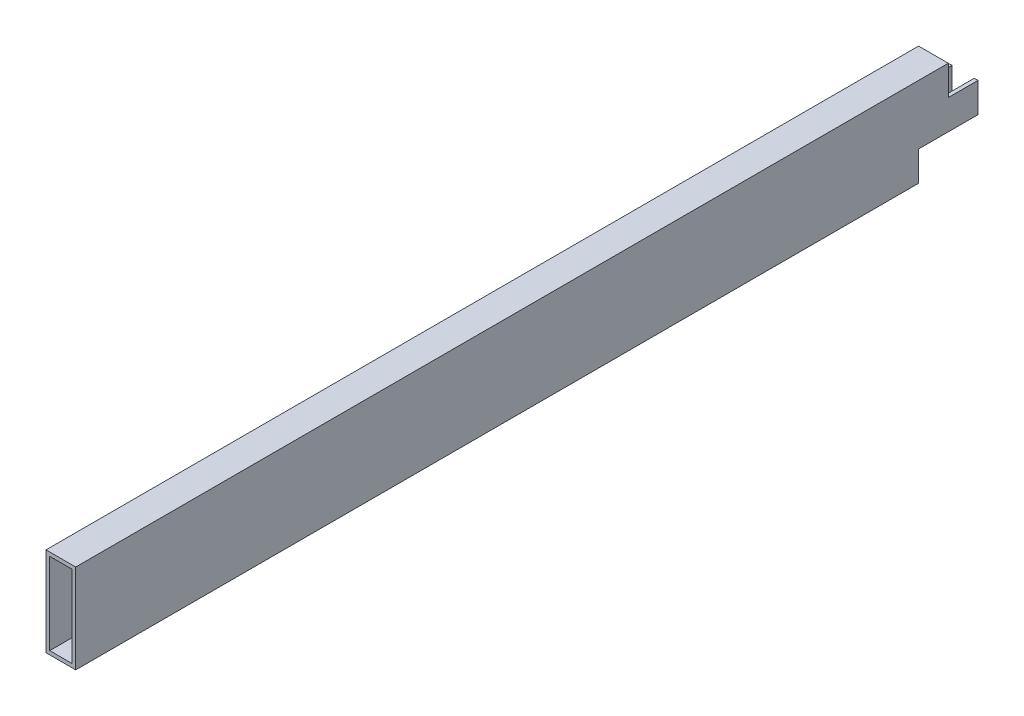
from build123d import *

# Parameters (mm, degrees)
SKETCH1_W           = 25.4
SKETCH1_H           = 76.2
BOSS_EXTRUDE1_DEPTH = 385.699
SHELL1_T            = -3.175
SKETCH2_W           = 50.8
SKETCH2_H           = 25.4
CUT_EXTRUDE1_DEPTH  = 389.407632007
SKETCH3_W           = 25.4
SKETCH3_H           = 25.4
CUT_EXTRUDE2_DEPTH  = 389.407632007


with BuildPart() as part:
    # Sketch1 → Boss-Extrude1 (new, symmetric)
    with BuildSketch(Plane.XY):
        Rectangle(SKETCH1_W, SKETCH1_H)
    extrude(amount=BOSS_EXTRUDE1_DEPTH, both=True)

    # Shell1
    shell1_openings = [part.faces().sort_by_distance(p)[0] for p in [
        (0, 0, -385.699),
        (0, 0, 385.699),
    ]]
    offset(amount=SHELL1_T, openings=shell1_openings, kind=Kind.INTERSECTION)

    # Sketch2 → Cut-Extrude1 (cut, through all)
    with BuildSketch(Plane(origin=(12.7, 0, 0), x_dir=(0, 0, -1), z_dir=(1, 0, 0))):
        with Locations((360.299, -25.4)):
            Rectangle(SKETCH2_W, SKETCH2_H)
    extrude(amount=-CUT_EXTRUDE1_DEPTH, mode=Mode.SUBTRACT)

    # Sketch3 → Cut-Extrude2 (cut, through all)
    with BuildSketch(Plane(origin=(12.7, 0, 0), x_dir=(0, 0, -1), z_dir=(1, 0, 0))):
        with Locations((372.999, 25.4)):
            Rectangle(SKETCH3_W, SKETCH3_H)
    extrude(amount=-CUT_EXTRUDE2_DEPTH, mode=Mode.SUBTRACT)


solid = part.part
